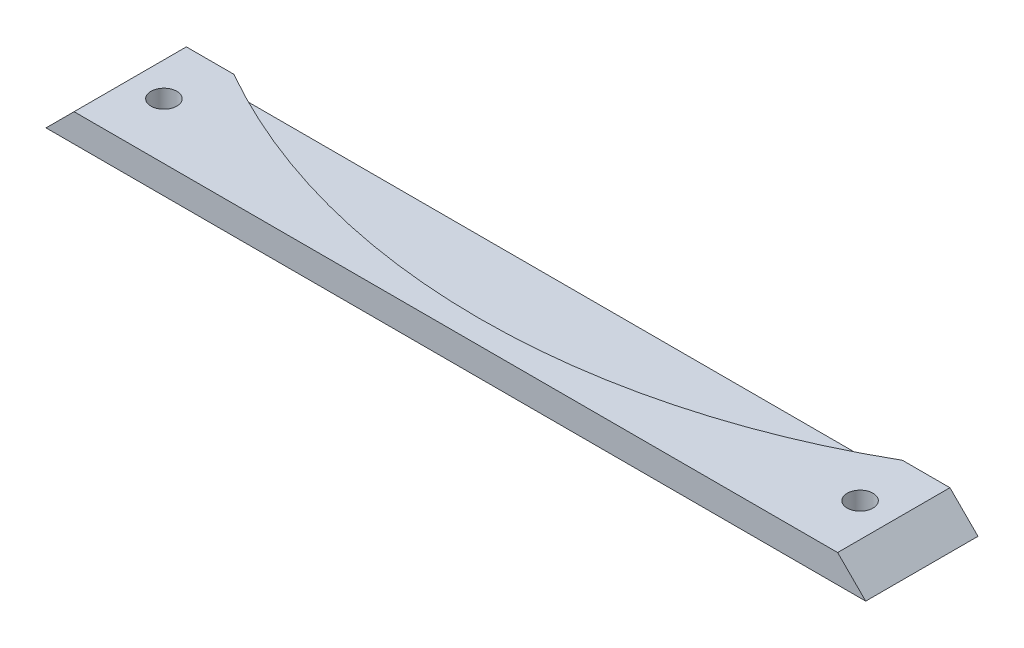
from build123d import *

# Parameters (mm, degrees)
SKETCH1_W           = 150
SKETCH1_H           = 20
BOSS_EXTRUDE1_DEPTH = 5
SKETCH2_R           = 120.1
CUT_EXTRUDE1_DEPTH  = 3
SKETCH3_R           = 2.3
CUT_EXTRUDE4_DEPTH  = 76.828754441
CHAMFER1_SIZE       = 7


with BuildPart() as part:
    # Sketch1 → Boss-Extrude1 (new body)
    with BuildSketch(Plane(origin=(0, 0, 0), x_dir=(1, 0, 0), z_dir=(0, 1, 0))):
        Rectangle(SKETCH1_W, SKETCH1_H)
    extrude(amount=BOSS_EXTRUDE1_DEPTH)

    # Sketch2 → Cut-Extrude1 (cut)
    with BuildSketch(Plane(origin=(0, 5, 0), x_dir=(1, 0, 0), z_dir=(0, 1, 0))):
        with Locations((0, 114.3)):
            Circle(SKETCH2_R)
    extrude(amount=-CUT_EXTRUDE1_DEPTH, mode=Mode.SUBTRACT)

    # Sketch3 → Cut-Extrude4 (cut, through all)
    with BuildSketch(Plane(origin=(0, 0, 0), x_dir=(1, 0, 0), z_dir=(0, 1, 0))):
        with Locations(Location((-62, 0, 0), (0, 0, 270))):
            Circle(SKETCH3_R)
        with Locations(Location((62, 0, 0), (0, 0, 270))):
            Circle(SKETCH3_R)
    extrude(amount=CUT_EXTRUDE4_DEPTH, mode=Mode.SUBTRACT)

    # Chamfer1
    # the kernel refuses this chamfer: 7 mm, written as the material it takes off along each edge
    with BuildSketch(Plane(origin=(75, 5, 28.001780916), x_dir=(0.02749587661058612, -0.9996219169112968, 0), z_dir=(0, 0, -1)), Plane(origin=(-75, 5, -28.001780916), x_dir=(-0.02749587661058612, -0.9996219169112968, 0), z_dir=(0, 0, 1))) as chamfer1_piece_1:
        Polygon((CHAMFER1_SIZE * 0.999621916911, CHAMFER1_SIZE * 0.0274958766106), (-CHAMFER1_SIZE * 0.0274958766106, CHAMFER1_SIZE * 0.999621916911), (0, 0), align=None)
    extrude(amount=56.003561832, mode=Mode.SUBTRACT)


solid = part.part
